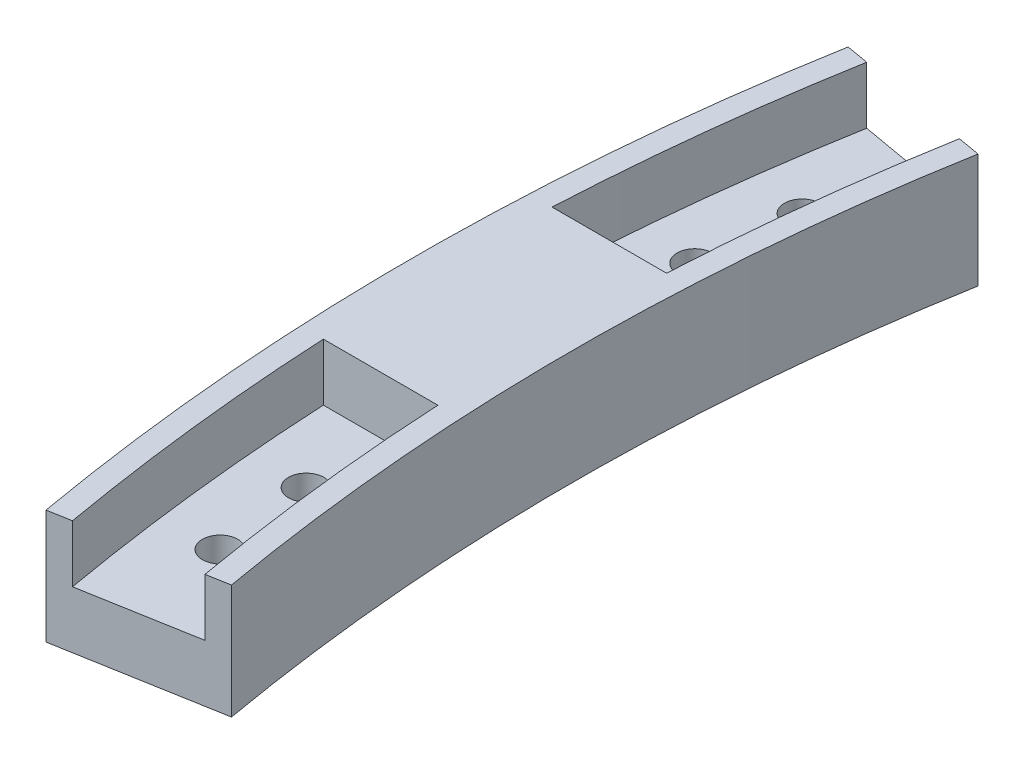
from build123d import *

# Parameters (mm, degrees)
BOSS_EXTRUDE1_DEPTH        = 10
CUT_EXTRUDE1_DEPTH         = 5
F_3_1_3_1_DIAMETER_HOLE2_D = 3.1


with BuildPart() as part:
    # Sketch1 → Boss-Extrude1 (new body)
    with BuildSketch(Plane(origin=(0, 0, 0), x_dir=(1, 0, 0), z_dir=(0, 1, 0))):
        with BuildLine():
            Line((-198.931166108, -35.076931889), (-185.143857566, -32.645857401))
            ThreePointArc((-185.143857566, -32.645857401), (-188, 0), (-185.143857566, 32.645857401))
            Line((-185.143857566, 32.645857401), (-198.931166108, 35.076931889))
            ThreePointArc((-198.931166108, 35.076931889), (-202, 0), (-198.931166108, -35.076931889))
        make_face()
    extrude(amount=BOSS_EXTRUDE1_DEPTH)

    # Sketch15 → Cut-Extrude1 (cut)
    with BuildSketch(Plane(origin=(0, 10, 0), x_dir=(1, 0, 0), z_dir=(0, 1, 0))):
        with BuildLine():
            Line((-199.749843554, 10), (-189.73665961, 10))
            ThreePointArc((-189.73665961, 10), (-188.775466906, 21.536552519), (-187.113473072, 32.993153757))
            Line((-187.113473072, 32.993153757), (-196.961550602, 34.729635533))
            ThreePointArc((-196.961550602, 34.729635533), (-198.7407137, 22.408228804), (-199.749843554, 10))
        make_face()
        with BuildLine():
            ThreePointArc((-187.113473072, -32.993153757), (-188.775466906, -21.536552519), (-189.73665961, -10))
            Line((-189.73665961, -10), (-199.749843554, -10))
            ThreePointArc((-199.749843554, -10), (-198.7407137, -22.408228804), (-196.961550602, -34.729635533))
            Line((-196.961550602, -34.729635533), (-187.113473072, -32.993153757))
        make_face()
    extrude(amount=-CUT_EXTRUDE1_DEPTH, mode=Mode.SUBTRACT)

    # Ø3.1 (3.1) Diameter Hole2 (through all)
    with Locations(Plane(origin=(0, 0, 0), x_dir=(-1, 0, 0), z_dir=(0, -1, 0))):
        with Locations((193.331747968, -25.452607483), (194.257966128, -16.995369836), (194.257966128, 16.995369836), (193.331747968, 25.452607483)):
            Hole(F_3_1_3_1_DIAMETER_HOLE2_D / 2)


solid = part.part
